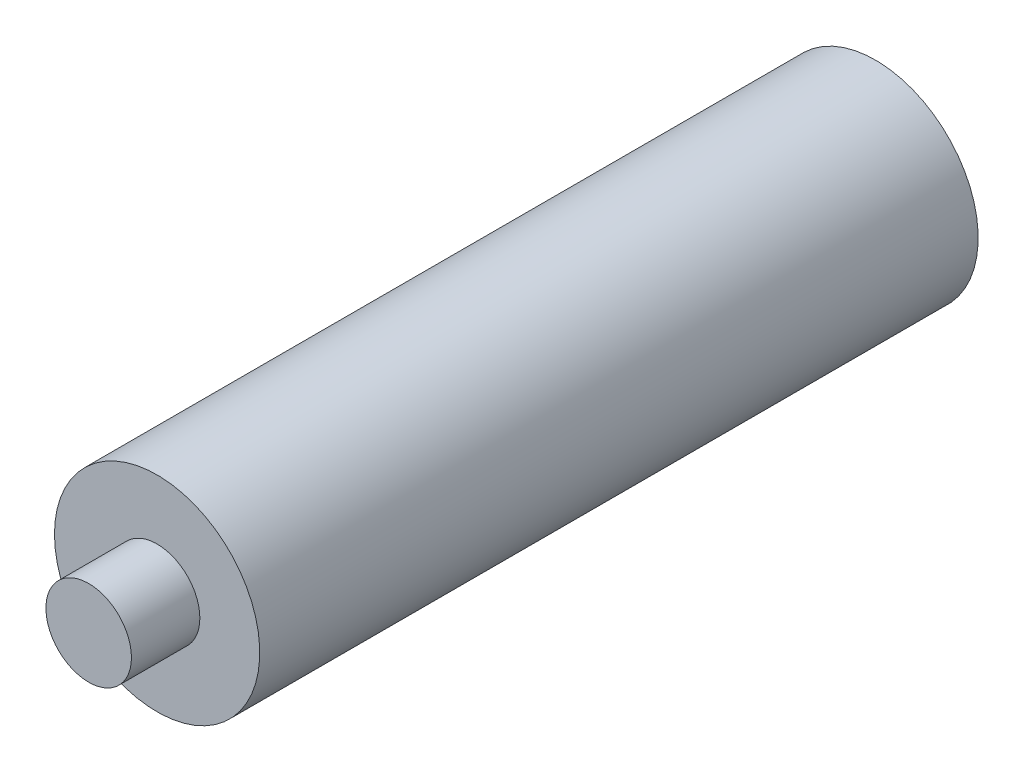
from build123d import *

# Parameters (mm, degrees)
SKETCH1_R           = 3
BOSS_EXTRUDE1_DEPTH = 21
SKETCH2_R           = 1.25
BOSS_EXTRUDE2_DEPTH = 2


with BuildPart() as part:
    # Sketch1 → Boss-Extrude1 (new body)
    with BuildSketch(Plane.XY):
        Circle(SKETCH1_R)
    extrude(amount=BOSS_EXTRUDE1_DEPTH)

    # Sketch2 → Boss-Extrude2 (add)
    with BuildSketch(Plane.XY.offset(21)):
        Circle(SKETCH2_R)
    extrude(amount=BOSS_EXTRUDE2_DEPTH)


solid = part.part
